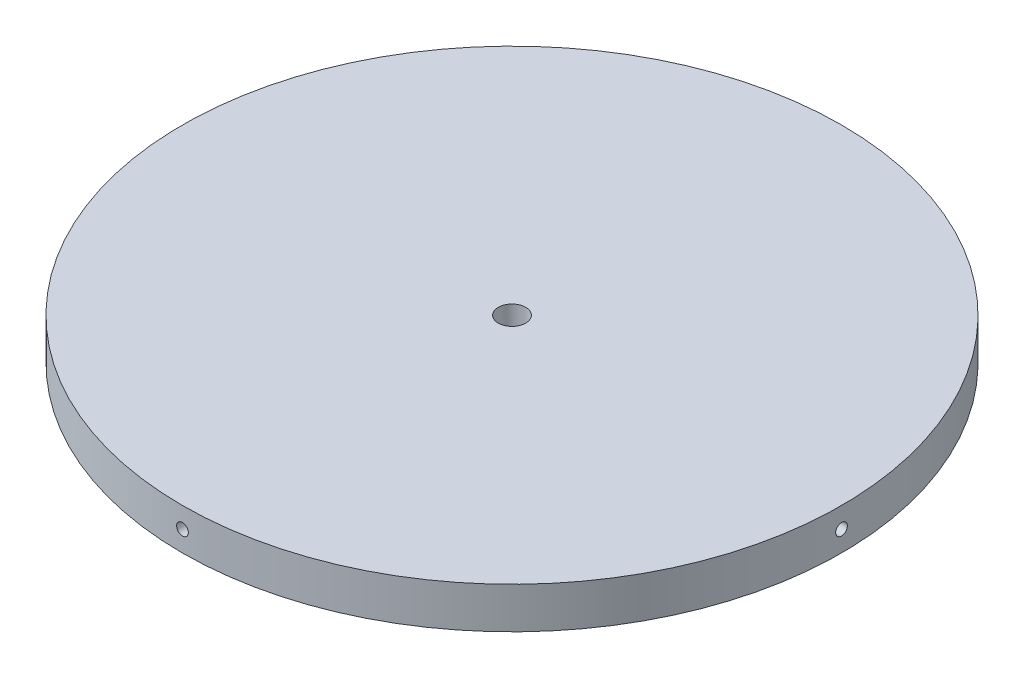
from build123d import *

# Parameters (mm, degrees)
SKETCH1_R           = 76.2
SKETCH1_R_2         = 3.175
BOSS_EXTRUDE1_DEPTH = 4.7625
SKETCH5_R           = 1.35255
CUT_EXTRUDE1_DEPTH  = 19.05
CIRPATTERN5_COUNT   = 4


with BuildPart() as part:
    # Sketch1 → Boss-Extrude1 (new, symmetric)
    with BuildSketch(Plane(origin=(0, 0, 0), x_dir=(1, 0, 0), z_dir=(0, 1, 0))):
        Circle(SKETCH1_R)
        Circle(SKETCH1_R_2, mode=Mode.SUBTRACT)
    extrude(amount=BOSS_EXTRUDE1_DEPTH, both=True)

    # Sketch5 → Cut-Extrude1 (cut)
    with BuildSketch(Plane.XY.offset(76.2)):
        Circle(SKETCH5_R)
    cut_extrude1 = extrude(amount=-CUT_EXTRUDE1_DEPTH, mode=Mode.SUBTRACT)

    # CirPattern5: Cut-Extrude1 ×4 about axis
    cirpattern5_axis = Axis((0, -5.272297454, 0), (0, 1, 0))
    for i in range(1, CIRPATTERN5_COUNT):
        add(cut_extrude1.rotate(cirpattern5_axis, i * 360 / CIRPATTERN5_COUNT), mode=Mode.SUBTRACT)


solid = part.part
